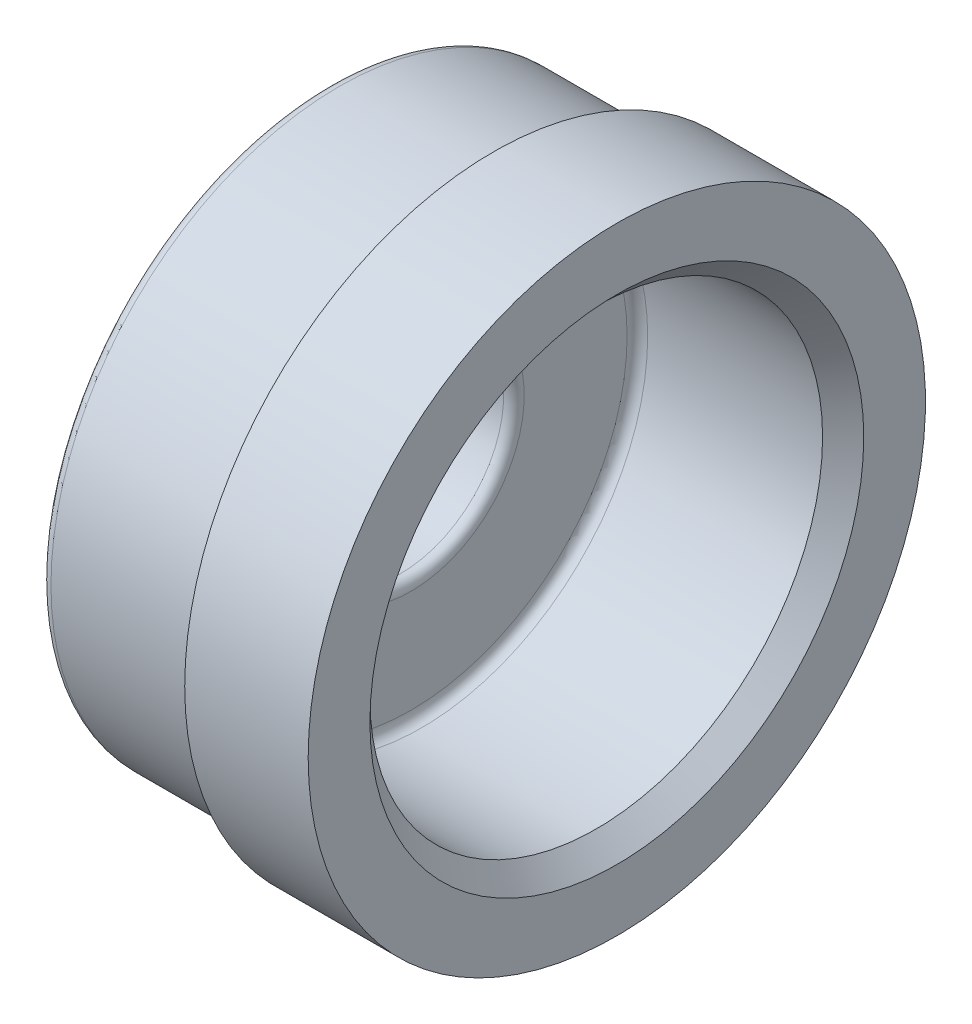
from build123d import *

# Parameters (mm, degrees)
REDONDEO1_R   = 0.5
CHAFL_N1_SIZE = 1


with BuildPart() as part:
    # Croquis1 → Revolución1 (revolve)
    with BuildSketch(Plane.XY):
        Polygon((0, 11), (10, 11), (10, 14), (10, 15), (4, 15), (4, 14), (-4, 14), (-4, 5), (0, 5), align=None)
    revolve(axis=Axis((-5.995381062, 0, 0), (1, 0, 0)))

    # Redondeo1
    redondeo1_edges = [part.edges().sort_by_distance(p)[0] for p in [
        (-4, -14, 0),
        (-4, -5, 0),
        (0, -5, 0),
        (0, -11, 0),
    ]]
    fillet(redondeo1_edges, radius=REDONDEO1_R)

    # Chaflán1
    chafl_n1_edges = [part.edges().sort_by_distance(p)[0] for p in [
        (10, -11, 0),
    ]]
    chamfer(chafl_n1_edges, length=CHAFL_N1_SIZE)


solid = part.part
